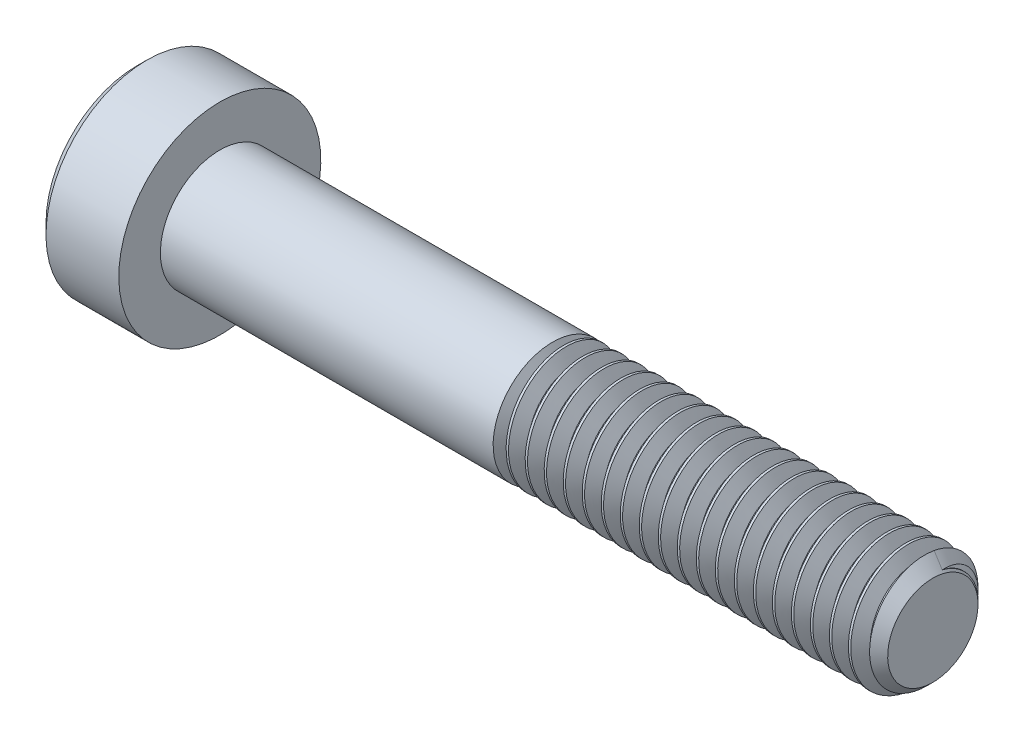
from build123d import *

# Parameters (mm, degrees)
SKETCH2_R           = 2.5
BOSS_EXTRUDE1_DEPTH = 16
CHAMFER1_SIZE       = 0.6
CUT_SWEEP1_PITCH    = 0.8
CUT_EXTRUDE1_DEPTH  = 2.82


with BuildPart() as part:
    # Sketch2 → Boss-Extrude1 (new body)
    with BuildSketch(Plane(origin=(15, 0, 0), x_dir=(0, 0, -1), z_dir=(1, 0, 0))):
        Circle(SKETCH2_R)
    extrude(amount=-BOSS_EXTRUDE1_DEPTH)

    # Chamfer1
    chamfer1_edges = [part.edges().sort_by_distance(p)[0] for p in [
        (15, 0, 2.5),
    ]]
    chamfer(chamfer1_edges, length=CHAMFER1_SIZE)

    # Cut-Sweep1: the profile of Sketch5 profile screwed along a right-hand helix of 21 turns, 8 arcs to a turn; built about Z, then put on its axis
    cut_sweep1_z = Axis((0, 0, 0), (0, 0, 1))
    cut_sweep1_corners = [(2.5003, 0, 0.350173205), (2.5003, 0, -0.350173205), (1.980384758, 0, -0.05), (1.980384758, 0, 0.05)]
    with BuildLine(mode=Mode.PRIVATE) as cut_sweep1_profile:
        Line(cut_sweep1_corners[0], cut_sweep1_corners[1])
        Line(cut_sweep1_corners[1], cut_sweep1_corners[2])
        Line(cut_sweep1_corners[2], cut_sweep1_corners[3])
        Line(cut_sweep1_corners[3], cut_sweep1_corners[0])
    cut_sweep1_cap = Face(cut_sweep1_profile.wire())
    cut_sweep1_turn_angles = [0, 22.5, 45, 67.5, 90, 112.5, 135, 157.5, 180, 202.5, 225, 247.5, 270, 292.5, 315, 337.5, 360]
    cut_sweep1_turn_weights = [1, 0.9238795325112867, 1, 0.9238795325112867, 1, 0.9238795325112867, 1, 0.9238795325112867, 1, 0.9238795325112867, 1, 0.9238795325112867, 1, 0.9238795325112867, 1, 0.9238795325112867, 1]
    cut_sweep1_turn_rails = [Edge.make_bspline([Vector(p[0], p[1], 0).rotate(cut_sweep1_z, cut_sweep1_turn_angles[k]) / cut_sweep1_turn_weights[k] + Vector(0, 0, p[2] + CUT_SWEEP1_PITCH * cut_sweep1_turn_angles[k] / 360) for k in range(17)], [0, 0, 0, 1, 1, 2, 2, 3, 3, 4, 4, 5, 5, 6, 6, 7, 7, 8, 8, 8], 2, cut_sweep1_turn_weights) for p in cut_sweep1_corners]
    cut_sweep1_turn_sides = [Face.make_surface_from_curves(cut_sweep1_turn_rails[p[0]], cut_sweep1_turn_rails[p[1]]) for p in [(0, 1), (1, 2), (2, 3), (3, 0)]]
    cut_sweep1 = Plane(origin=(15, 0, 0), x_dir=(0, 1, 0), z_dir=(-1, 0, 0)) * Solid(Shell([*[p.moved(Location((0, 0, CUT_SWEEP1_PITCH * i))) for i in range(21) for p in cut_sweep1_turn_sides], cut_sweep1_cap, cut_sweep1_cap.rotate(cut_sweep1_z, 7560).moved(Location((0, 0, CUT_SWEEP1_PITCH * 7560 / 360)))]))
    add(cut_sweep1, mode=Mode.SUBTRACT)

    # Sketch10 → Revolve2 (revolve)
    with BuildSketch(Plane.XY, mode=Mode.PRIVATE) as revolve2_sk:
        Polygon((0.443375673, 0), (-1, 2.5), (-15, 2.5), (-15, 0), align=None)
    revolve(revolve2_sk.sketch.rotate(Axis((-15, 0, 0), (1, 0, 0)), 292.5), axis=Axis((-15, 0, 0), (1, 0, 0)))

    # Sketch6 → Revolve1 (revolve)
    with BuildSketch(Plane.XY, mode=Mode.PRIVATE) as revolve1_sk:
        Polygon((-18.0625, 4.25), (-18.5, 3.8125), (-18.5, 0), (-15, 0), (-15, 4.25), align=None)
    revolve(revolve1_sk.sketch.rotate(Axis((-15, 0, 0), (-1, 0, 0)), 67.5), axis=Axis((-15, 0, 0), (-1, 0, 0)))

    # Sketch4 → Cut-Extrude1 (cut)
    with BuildSketch(Plane(origin=(-18.5, 0, 0), x_dir=(0, 0, -1), z_dir=(1, 0, 0))):
        Polygon((0, 1.732050808), (-1.5, 0.866025404), (-1.5, -0.866025404), (0, -1.732050808), (1.5, -0.866025404), (1.5, 0.866025404), align=None)
    extrude(amount=CUT_EXTRUDE1_DEPTH, mode=Mode.SUBTRACT)

    # Cut-Extrude2 cone 1 section (through the dimple's axis) → Cut-Extrude2 (revolve, cut)
    with BuildSketch(Plane(origin=(-18.5, 0, 0), x_dir=(0, 0, 1), z_dir=(0, 1, 0))):
        Polygon((0, 0), (1.732050808, 0), (0, 1.732050808), align=None)
    revolve(axis=Axis((-18.5, 0, 0), (1, 0, 0)), mode=Mode.SUBTRACT)


solid = part.part
